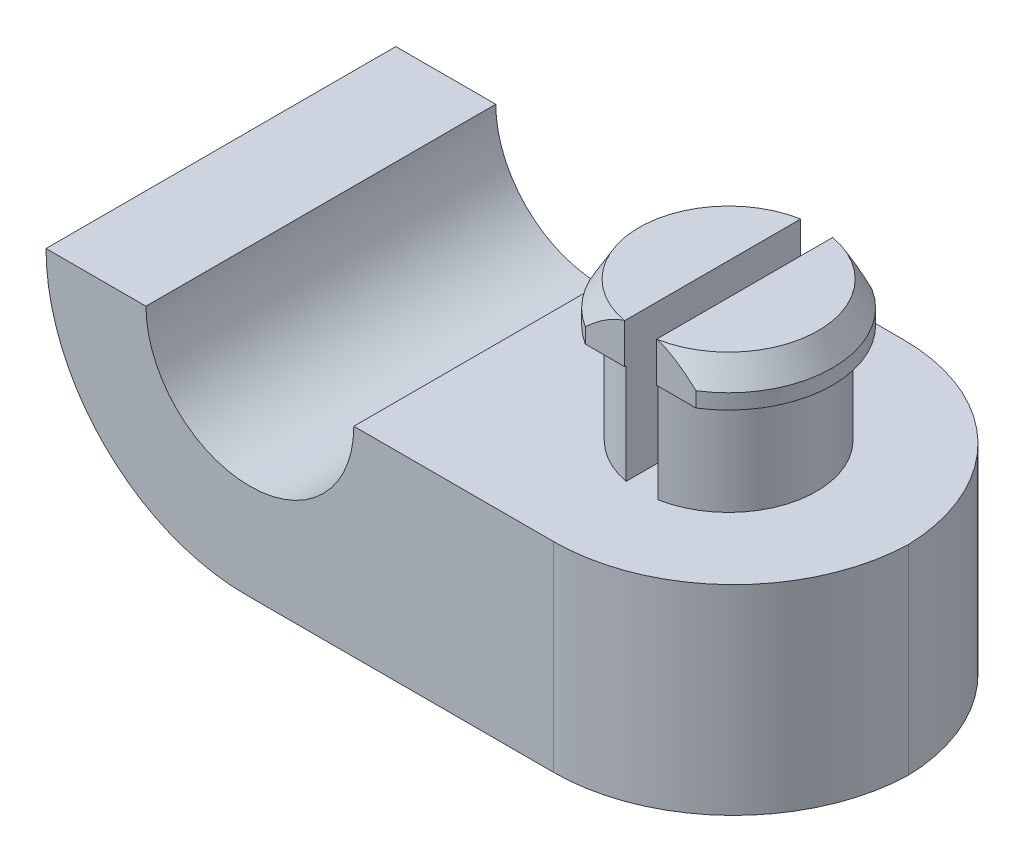
from build123d import *
from OCP.BRepFilletAPI import BRepFilletAPI_MakeChamfer

# Parameters (mm, degrees)
BOSS_EXTRUDE1_DEPTH = 11.1125
FILLET1_R           = 6.35
FILLET2_R           = 5.715
SKETCH2_R           = 2.794
BOSS_EXTRUDE2_DEPTH = 3.175
BOSS_EXTRUDE3_DEPTH = 1.27
SKETCH4_W           = 1.016
SKETCH4_H           = 4.445
CUT_EXTRUDE2_DEPTH  = 20.997176622
CHAMFER1_SIZE       = 0.79375
CHAMFER1_SIZE2      = 0.458271776


# Some blends are built 0.0001 mm under size
with BuildPart() as part:
    # Sketch1 → Boss-Extrude1 (new body)
    with BuildSketch(Plane.XY):
        with BuildLine():
            Line((3.302, 0), (15.367, 0))
            Line((15.367, 0), (15.367, -6.35))
            Line((15.367, -6.35), (-6.477, -6.35))
            Line((-6.477, -6.35), (-6.477, 0))
            Line((-6.477, 0), (-3.302, 0))
            ThreePointArc((-3.302, 0), (0, -3.302), (3.302, 0))
        make_face()
    extrude(amount=BOSS_EXTRUDE1_DEPTH)

    # Fillet1
    fillet1_edges = [part.edges().sort_by_distance(p)[0] for p in [
        (-6.477, -6.35, 5.55625),
    ]]
    fillet(fillet1_edges, radius=FILLET1_R - 0.0001)  # a hair under: the kernel refuses the full size

    # Fillet2
    # the kernel refuses this fillet: 5.715 mm, written as the material it takes off along each edge
    with BuildSketch(Plane(origin=(15.367, 14.2875, 0), x_dir=(-1, 0, 0), z_dir=(0, -1, 0)), Plane(origin=(15.367, 14.2875, 11.1125), x_dir=(0, 0, -1), z_dir=(0, -1, 0))) as fillet2_piece_1:
        with BuildLine():
            CenterArc((FILLET2_R, -FILLET2_R), FILLET2_R, 90, 90)
            Line((0, -FILLET2_R), (0, 0))
            Line((0, 0), (FILLET2_R, 0))
        make_face()
    extrude(amount=34.925, mode=Mode.SUBTRACT)

    # Sketch2 → Boss-Extrude2 (add)
    with BuildSketch(Plane(origin=(0, 0, 0), x_dir=(1, 0, 0), z_dir=(0, 1, 0))):
        with Locations(Location((9.652, -5.55625, 0), (0, 0, 270))):
            Circle(SKETCH2_R)
    extrude(amount=BOSS_EXTRUDE2_DEPTH)

    # Sketch3 → Boss-Extrude3 (add)
    with BuildSketch(Plane(origin=(0, 3.175, 0), x_dir=(1, 0, 0), z_dir=(0, 1, 0))):
        with BuildLine():
            Line((7.89223638, -8.35025), (11.41176362, -8.35025))
            ThreePointArc((11.41176362, -8.35025), (12.954, -5.55625), (11.41176362, -2.76225))
            Line((11.41176362, -2.76225), (7.89223638, -2.76225))
            ThreePointArc((7.89223638, -2.76225), (6.35, -5.55625), (7.89223638, -8.35025))
        make_face()
    extrude(amount=BOSS_EXTRUDE3_DEPTH)

    # Sketch4 → Cut-Extrude2 (cut, through all)
    with BuildSketch(Plane.XY):
        with Locations((9.652, 2.2225)):
            Rectangle(SKETCH4_W, SKETCH4_H)
    extrude(amount=CUT_EXTRUDE2_DEPTH, mode=Mode.SUBTRACT)

    # Chamfer1: one chamfer whose edges measure the first distance from different faces: ONE call of the kernel's chamfer builder (chamfer() names one face for all edges)
    chamfer1_edges_1 = [part.edges().sort_by_distance(p)[0] for p in [
        (6.35, 4.445, 5.55625),
    ]]
    chamfer1_side_1 = [part.faces().sort_by_distance(p)[0] for p in [
        (6.35, 3.81, 5.55625),
    ]]
    chamfer1_edges_2 = [part.edges().sort_by_distance(p)[0] for p in [
        (12.954, 4.445, 5.55625),
    ]]
    chamfer1_side_2 = [part.faces().sort_by_distance(p)[0] for p in [
        (12.954, 3.81, 5.55625),
    ]]
    chamfer1 = BRepFilletAPI_MakeChamfer(part.part.solid().wrapped)
    for e in chamfer1_edges_1:
        chamfer1.Add(CHAMFER1_SIZE, CHAMFER1_SIZE2, e.wrapped, chamfer1_side_1[0].wrapped)  # the first distance lies on this face
    for e in chamfer1_edges_2:
        chamfer1.Add(CHAMFER1_SIZE, CHAMFER1_SIZE2, e.wrapped, chamfer1_side_2[0].wrapped)  # the first distance lies on this face
    add(Compound.cast(chamfer1.Shape()), mode=Mode.REPLACE)


solid = part.part
